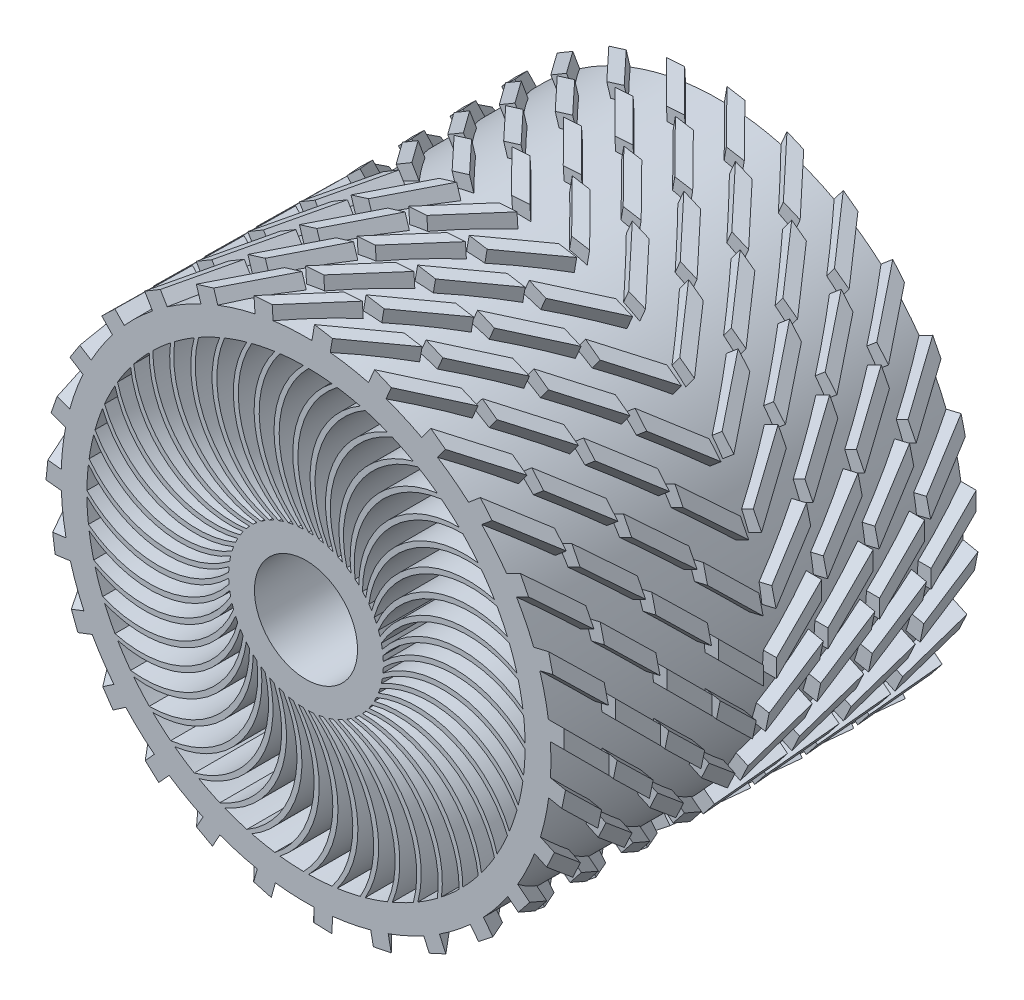
from build123d import *

# Parameters (mm, degrees)
SKETCH1_R           = 120.65
SKETCH1_R_2         = 25.4
BOSS_EXTRUDE2_DEPTH = 203.2
BOSS_EXTRUDE3_REACH = 344.312
CIRPATTERN1_COUNT   = 27
CIRPATTERN1_ANGLE   = 348.4


with BuildPart() as part:
    # Sketch1 → Boss-Extrude2 (new body)
    with BuildSketch(Plane.XY):
        Circle(SKETCH1_R)
        with BuildLine():
            ThreePointArc((1.239671441, 107.942881723), (7.029570809, 107.720878358), (12.799218379, 107.188537208))
            ThreePointArc((12.799218379, 107.188537208), (-6.095938305, 74.436927794), (3.709061895, 37.919030313))
            ThreePointArc((3.709061895, 37.919030313), (2.489766262, 38.018562098), (1.267903716, 38.078897308))
            ThreePointArc((1.267903716, 38.078897308), (-13.219615705, 73.005040764), (1.239671441, 107.942881723))
        make_face(mode=Mode.SUBTRACT)
        with BuildLine():
            ThreePointArc((-1.30119232, 107.942157652), (-15.759755454, 73.004429943), (-1.272096284, 38.078757478))
            ThreePointArc((-1.272096284, 38.078757478), (-2.493952178, 38.018287738), (-3.713236845, 37.918621707))
            ThreePointArc((-3.713236845, 37.918621707), (-22.635590043, 70.654966419), (-12.860307449, 107.181224999))
            ThreePointArc((-12.860307449, 107.181224999), (-7.090964218, 107.716854421), (-1.30119232, 107.942157652))
        make_face(mode=Mode.SUBTRACT)
        Circle(SKETCH1_R_2, mode=Mode.SUBTRACT)
        with BuildLine():
            ThreePointArc((8.626756995, 37.110498026), (7.43088411, 37.368328319), (6.227350094, 37.587632418))
            ThreePointArc((6.227350094, 37.587632418), (-3.577450076, 74.10597862), (15.318439209, 106.857605814))
            ThreePointArc((15.318439209, 106.857605814), (21.029827931, 105.8817682), (26.680630903, 104.600891175))
            ThreePointArc((26.680630903, 104.600891175), (3.672182037, 74.595789173), (8.626756995, 37.110498026))
        make_face(mode=Mode.SUBTRACT)
        with BuildLine():
            ThreePointArc((13.396845892, 35.666994829), (12.244857472, 36.078712082), (11.080244785, 36.453232717))
            ThreePointArc((11.080244785, 36.453232717), (6.125926715, 73.938942636), (29.135104234, 103.943966642))
            ThreePointArc((29.135104234, 103.943966642), (34.670258866, 102.230991632), (40.105530435, 100.223494893))
            ThreePointArc((40.105530435, 100.223494893), (13.377470327, 73.478295917), (13.396845892, 35.666994829))
        make_face(mode=Mode.SUBTRACT)
        with BuildLine():
            ThreePointArc((17.937711041, 33.613219462), (16.849317927, 34.171779079), (15.743553415, 34.695108097))
            ThreePointArc((15.743553415, 34.695108097), (15.724487202, 72.506790844), (42.453259549, 99.251817382))
            ThreePointArc((42.453259549, 99.251817382), (47.71747206, 96.831014454), (52.844213222, 94.131246826))
            ThreePointArc((52.844213222, 94.131246826), (22.853866391, 71.103568646), (17.937711041, 33.613219462))
        make_face(mode=Mode.SUBTRACT)
        with BuildLine():
            ThreePointArc((22.171656981, 30.98431259), (21.165481881, 31.680157461), (20.137485482, 32.343340558))
            ThreePointArc((20.137485482, 32.343340558), (25.053997353, 69.834027758), (55.045027822, 92.861442009))
            ThreePointArc((55.045027822, 92.861442009), (59.948226077, 89.774231772), (64.678716869, 86.428387027))
            ThreePointArc((64.678716869, 86.428387027), (31.939226465, 67.512239602), (22.171656981, 30.984312591))
        make_face(mode=Mode.SUBTRACT)
        with BuildLine():
            ThreePointArc((26.026239723, 27.82525554), (25.119498571, 28.646479566), (24.186859589, 29.438169495))
            ThreePointArc((24.186859589, 29.438169495), (33.954826663, 65.966385095), (66.694960408, 84.882181618))
            ThreePointArc((66.694960408, 84.882181618), (71.153249325, 81.181387094), (75.406549739, 77.246713565))
            ThreePointArc((75.406549739, 77.246713565), (40.478097518, 62.76575742), (26.026239723, 27.82525554))
        make_face(mode=Mode.SUBTRACT)
        with BuildLine():
            ThreePointArc((29.435506288, 24.190100653), (28.643713677, 25.122652463), (27.822389822, 26.029303191))
            ThreePointArc((27.822389822, 26.029303191), (42.274679475, 60.970039294), (77.20372373, 75.450563565))
            ThreePointArc((77.20372373, 75.450563565), (81.14082075, 71.199506375), (84.844155635, 66.743327416))
            ThreePointArc((84.844155635, 66.743327416), (48.3243771, 56.945335727), (29.435506288, 24.190100653))
        make_face(mode=Mode.SUBTRACT)
        with BuildLine():
            ThreePointArc((32.341123178, 20.141046436), (31.6778269, 21.168969811), (30.981871252, 22.175068291))
            ThreePointArc((30.981871252, 22.175068291), (49.871200801, 54.930479217), (86.391509934, 64.727965451))
            ThreePointArc((86.391509934, 64.727965451), (89.740050235, 59.999382361), (92.830054506, 55.09794443))
            ThreePointArc((92.830054506, 55.09794443), (55.343813192, 50.150563552), (32.341123178, 20.141046436))
        make_face(mode=Mode.SUBTRACT)
        with BuildLine():
            ThreePointArc((34.693374485, 15.747373332), (34.169923723, 16.853080217), (33.611244275, 17.941411826))
            ThreePointArc((33.611244275, 17.941411826), (56.614412053, 47.95104341), (94.101113451, 52.897853901))
            ThreePointArc((94.101113451, 52.897853901), (96.803802581, 47.772652281), (99.227605407, 42.509820339))
            ThreePointArc((99.227605407, 42.509820339), (61.416301297, 42.497701329), (34.693374485, 15.747373332))
        make_face(mode=Mode.SUBTRACT)
        with BuildLine():
            ThreePointArc((36.452012535, 11.084258303), (36.077363676, 12.248829747), (35.665519589, 13.40077283))
            ThreePointArc((35.665519589, 13.40077283), (62.388935019, 40.151151957), (100.200620826, 40.162645406))
            ThreePointArc((100.200620826, 40.162645406), (102.211215024, 34.728518875), (103.927344468, 29.194341436))
            ThreePointArc((103.927344468, 29.194341436), (66.437939458, 34.117691655), (36.452012535, 11.084258303))
        make_face(mode=Mode.SUBTRACT)
        with BuildLine():
            ThreePointArc((37.586946545, 6.231488542), (37.367509935, 7.434998405), (37.109547975, 8.630842895))
            ThreePointArc((37.109547975, 8.630842895), (67.09596601, 31.664263161), (104.585667799, 26.740242912))
            ThreePointArc((104.585667799, 26.740242912), (105.869765241, 21.090170882), (106.848857851, 15.379339257))
            ThreePointArc((106.848857851, 15.379339257), (70.322806055, 25.153918817), (37.586946545, 6.231488542))
        make_face(mode=Mode.SUBTRACT)
        with BuildLine():
            ThreePointArc((38.078757478, 1.272096284), (38.018287738, 2.493952178), (37.918621707, 3.713236845))
            ThreePointArc((37.918621707, 3.713236845), (70.654966419, 22.635590043), (107.181224999, 12.860307449))
            ThreePointArc((107.181224999, 12.860307449), (107.716854421, 7.090964218), (107.942157652, 1.30119232))
            ThreePointArc((107.942157652, 1.30119232), (73.004429943, 15.759755454), (38.078757478, 1.272096284))
        make_face(mode=Mode.SUBTRACT)
        with BuildLine():
            ThreePointArc((37.919030313, -3.709061895), (38.018562098, -2.489766262), (38.078897308, -1.267903716))
            ThreePointArc((38.078897308, -1.267903716), (73.005040764, 13.219615705), (107.942881723, -1.239671441))
            ThreePointArc((107.942881723, -1.239671441), (107.720878358, -7.029570809), (107.188537208, -12.799218379))
            ThreePointArc((107.188537208, -12.799218379), (74.436927794, 6.095938305), (37.919030313, -3.709061895))
        make_face(mode=Mode.SUBTRACT)
        with BuildLine():
            ThreePointArc((37.110498026, -8.626756995), (37.368328319, -7.43088411), (37.587632418, -6.227350094))
            ThreePointArc((37.587632418, -6.227350094), (74.10597862, 3.577450076), (106.857605814, -15.318439209))
            ThreePointArc((106.857605814, -15.318439209), (105.8817682, -21.029827931), (104.600891175, -26.680630903))
            ThreePointArc((104.600891175, -26.680630903), (74.595789173, -3.672182037), (37.110498026, -8.626756995))
        make_face(mode=Mode.SUBTRACT)
        with BuildLine():
            ThreePointArc((35.666994829, -13.396845892), (36.078712082, -12.244857472), (36.453232717, -11.080244785))
            ThreePointArc((36.453232717, -11.080244785), (73.938942636, -6.125926715), (103.943966642, -29.135104234))
            ThreePointArc((103.943966642, -29.135104234), (102.230991632, -34.670258866), (100.223494893, -40.105530435))
            ThreePointArc((100.223494893, -40.105530435), (73.478295917, -13.377470327), (35.666994829, -13.396845892))
        make_face(mode=Mode.SUBTRACT)
        with BuildLine():
            ThreePointArc((33.613219462, -17.937711041), (34.171779079, -16.849317927), (34.695108097, -15.743553415))
            ThreePointArc((34.695108097, -15.743553415), (72.506790844, -15.724487202), (99.251817382, -42.453259549))
            ThreePointArc((99.251817382, -42.453259549), (96.831014454, -47.71747206), (94.131246826, -52.844213222))
            ThreePointArc((94.131246826, -52.844213222), (71.103568646, -22.853866391), (33.613219462, -17.937711041))
        make_face(mode=Mode.SUBTRACT)
        with BuildLine():
            ThreePointArc((30.984312591, -22.171656981), (31.680157461, -21.165481881), (32.343340558, -20.137485482))
            ThreePointArc((32.343340558, -20.137485482), (69.834027758, -25.053997353), (92.861442009, -55.045027822))
            ThreePointArc((92.861442009, -55.045027822), (89.774231772, -59.948226077), (86.428387027, -64.678716869))
            ThreePointArc((86.428387027, -64.678716869), (67.512239602, -31.939226465), (30.984312591, -22.171656981))
        make_face(mode=Mode.SUBTRACT)
        with BuildLine():
            ThreePointArc((27.82525554, -26.026239723), (28.646479566, -25.119498571), (29.438169495, -24.186859589))
            ThreePointArc((29.438169495, -24.186859589), (65.966385095, -33.954826663), (84.882181618, -66.694960408))
            ThreePointArc((84.882181618, -66.694960408), (81.181387094, -71.153249325), (77.246713565, -75.406549739))
            ThreePointArc((77.246713565, -75.406549739), (62.76575742, -40.478097518), (27.82525554, -26.026239723))
        make_face(mode=Mode.SUBTRACT)
        with BuildLine():
            ThreePointArc((24.190100653, -29.435506288), (25.122652463, -28.643713677), (26.029303191, -27.822389822))
            ThreePointArc((26.029303191, -27.822389822), (60.970039294, -42.274679475), (75.450563565, -77.20372373))
            ThreePointArc((75.450563565, -77.20372373), (71.199506375, -81.14082075), (66.743327416, -84.844155635))
            ThreePointArc((66.743327416, -84.844155635), (56.945335727, -48.3243771), (24.190100653, -29.435506288))
        make_face(mode=Mode.SUBTRACT)
        with BuildLine():
            ThreePointArc((20.141046436, -32.341123178), (21.168969811, -31.6778269), (22.175068291, -30.981871252))
            ThreePointArc((22.175068291, -30.981871252), (54.930479217, -49.871200801), (64.727965451, -86.391509934))
            ThreePointArc((64.727965451, -86.391509934), (59.999382361, -89.740050235), (55.09794443, -92.830054506))
            ThreePointArc((55.09794443, -92.830054506), (50.150563552, -55.343813192), (20.141046436, -32.341123178))
        make_face(mode=Mode.SUBTRACT)
        with BuildLine():
            ThreePointArc((15.747373332, -34.693374485), (16.853080217, -34.169923723), (17.941411826, -33.611244275))
            ThreePointArc((17.941411826, -33.611244275), (47.95104341, -56.614412053), (52.897853901, -94.101113451))
            ThreePointArc((52.897853901, -94.101113451), (47.772652281, -96.803802581), (42.509820339, -99.227605407))
            ThreePointArc((42.509820339, -99.227605407), (42.497701329, -61.416301297), (15.747373332, -34.693374485))
        make_face(mode=Mode.SUBTRACT)
        with BuildLine():
            ThreePointArc((11.084258303, -36.452012535), (12.248829747, -36.077363676), (13.40077283, -35.665519589))
            ThreePointArc((13.40077283, -35.665519589), (40.151151957, -62.388935019), (40.162645406, -100.200620826))
            ThreePointArc((40.162645406, -100.200620826), (34.728518875, -102.211215024), (29.194341436, -103.927344468))
            ThreePointArc((29.194341436, -103.927344468), (34.117691655, -66.437939458), (11.084258303, -36.452012535))
        make_face(mode=Mode.SUBTRACT)
        with BuildLine():
            ThreePointArc((6.231488542, -37.586946545), (7.434998405, -37.367509935), (8.630842895, -37.109547975))
            ThreePointArc((8.630842895, -37.109547975), (31.664263161, -67.09596601), (26.740242912, -104.585667799))
            ThreePointArc((26.740242912, -104.585667799), (21.090170882, -105.869765241), (15.379339257, -106.848857851))
            ThreePointArc((15.379339257, -106.848857851), (25.153918817, -70.322806055), (6.231488542, -37.586946545))
        make_face(mode=Mode.SUBTRACT)
        with BuildLine():
            ThreePointArc((1.272096284, -38.078757478), (2.493952178, -38.018287738), (3.713236845, -37.918621707))
            ThreePointArc((3.713236845, -37.918621707), (22.635590043, -70.654966419), (12.860307449, -107.181224999))
            ThreePointArc((12.860307449, -107.181224999), (7.090964218, -107.716854421), (1.30119232, -107.942157652))
            ThreePointArc((1.30119232, -107.942157652), (15.759755454, -73.004429943), (1.272096284, -38.078757478))
        make_face(mode=Mode.SUBTRACT)
        with BuildLine():
            ThreePointArc((-3.709061894, -37.919030313), (-2.489766262, -38.018562098), (-1.267903716, -38.078897308))
            ThreePointArc((-1.267903716, -38.078897308), (13.219615705, -73.005040764), (-1.239671441, -107.942881723))
            ThreePointArc((-1.239671441, -107.942881723), (-7.029570809, -107.720878358), (-12.799218379, -107.188537208))
            ThreePointArc((-12.799218379, -107.188537208), (6.095938305, -74.436927794), (-3.709061894, -37.919030313))
        make_face(mode=Mode.SUBTRACT)
        with BuildLine():
            ThreePointArc((-8.626756995, -37.110498026), (-7.43088411, -37.368328319), (-6.227350094, -37.587632418))
            ThreePointArc((-6.227350094, -37.587632418), (3.577450076, -74.10597862), (-15.318439209, -106.857605814))
            ThreePointArc((-15.318439209, -106.857605814), (-21.029827931, -105.8817682), (-26.680630903, -104.600891175))
            ThreePointArc((-26.680630903, -104.600891175), (-3.672182037, -74.595789173), (-8.626756995, -37.110498026))
        make_face(mode=Mode.SUBTRACT)
        with BuildLine():
            ThreePointArc((-13.396845892, -35.666994829), (-12.244857472, -36.078712082), (-11.080244785, -36.453232717))
            ThreePointArc((-11.080244785, -36.453232717), (-6.125926715, -73.938942636), (-29.135104234, -103.943966642))
            ThreePointArc((-29.135104234, -103.943966642), (-34.670258866, -102.230991632), (-40.105530435, -100.223494893))
            ThreePointArc((-40.105530435, -100.223494893), (-13.377470327, -73.478295917), (-13.396845892, -35.666994829))
        make_face(mode=Mode.SUBTRACT)
        with BuildLine():
            ThreePointArc((-17.937711041, -33.613219462), (-16.849317927, -34.171779079), (-15.743553415, -34.695108097))
            ThreePointArc((-15.743553415, -34.695108097), (-15.724487202, -72.506790844), (-42.453259549, -99.251817382))
            ThreePointArc((-42.453259549, -99.251817382), (-47.71747206, -96.831014454), (-52.844213222, -94.131246826))
            ThreePointArc((-52.844213222, -94.131246826), (-22.853866391, -71.103568646), (-17.937711041, -33.613219462))
        make_face(mode=Mode.SUBTRACT)
        with BuildLine():
            ThreePointArc((-22.171656981, -30.984312591), (-21.165481881, -31.680157461), (-20.137485482, -32.343340558))
            ThreePointArc((-20.137485482, -32.343340558), (-25.053997353, -69.834027758), (-55.045027822, -92.861442009))
            ThreePointArc((-55.045027822, -92.861442009), (-59.948226077, -89.774231772), (-64.678716869, -86.428387027))
            ThreePointArc((-64.678716869, -86.428387027), (-31.939226465, -67.512239602), (-22.171656981, -30.984312591))
        make_face(mode=Mode.SUBTRACT)
        with BuildLine():
            ThreePointArc((-26.026239723, -27.82525554), (-25.119498571, -28.646479566), (-24.186859589, -29.438169495))
            ThreePointArc((-24.186859589, -29.438169495), (-33.954826663, -65.966385095), (-66.694960408, -84.882181618))
            ThreePointArc((-66.694960408, -84.882181618), (-71.153249325, -81.181387094), (-75.406549739, -77.246713565))
            ThreePointArc((-75.406549739, -77.246713565), (-40.478097518, -62.76575742), (-26.026239723, -27.82525554))
        make_face(mode=Mode.SUBTRACT)
        with BuildLine():
            ThreePointArc((-29.435506288, -24.190100653), (-28.643713677, -25.122652463), (-27.822389822, -26.029303191))
            ThreePointArc((-27.822389822, -26.029303191), (-42.274679475, -60.970039294), (-77.20372373, -75.450563565))
            ThreePointArc((-77.20372373, -75.450563565), (-81.14082075, -71.199506375), (-84.844155635, -66.743327416))
            ThreePointArc((-84.844155635, -66.743327416), (-48.3243771, -56.945335727), (-29.435506288, -24.190100653))
        make_face(mode=Mode.SUBTRACT)
        with BuildLine():
            ThreePointArc((-32.341123178, -20.141046436), (-31.6778269, -21.168969811), (-30.981871252, -22.175068291))
            ThreePointArc((-30.981871252, -22.175068291), (-49.871200801, -54.930479217), (-86.391509934, -64.727965451))
            ThreePointArc((-86.391509934, -64.727965451), (-89.740050235, -59.999382361), (-92.830054506, -55.09794443))
            ThreePointArc((-92.830054506, -55.09794443), (-55.343813192, -50.150563552), (-32.341123178, -20.141046436))
        make_face(mode=Mode.SUBTRACT)
        with BuildLine():
            ThreePointArc((-34.693374485, -15.747373332), (-34.169923723, -16.853080217), (-33.611244275, -17.941411826))
            ThreePointArc((-33.611244275, -17.941411826), (-56.614412053, -47.95104341), (-94.101113451, -52.897853901))
            ThreePointArc((-94.101113451, -52.897853901), (-96.803802581, -47.772652281), (-99.227605407, -42.509820339))
            ThreePointArc((-99.227605407, -42.509820339), (-61.416301297, -42.497701329), (-34.693374485, -15.747373332))
        make_face(mode=Mode.SUBTRACT)
        with BuildLine():
            ThreePointArc((-36.452012535, -11.084258303), (-36.077363676, -12.248829747), (-35.665519589, -13.40077283))
            ThreePointArc((-35.665519589, -13.40077283), (-62.388935019, -40.151151957), (-100.200620826, -40.162645406))
            ThreePointArc((-100.200620826, -40.162645406), (-102.211215024, -34.728518875), (-103.927344468, -29.194341436))
            ThreePointArc((-103.927344468, -29.194341436), (-66.437939458, -34.117691655), (-36.452012535, -11.084258303))
        make_face(mode=Mode.SUBTRACT)
        with BuildLine():
            ThreePointArc((-37.586946545, -6.231488542), (-37.367509935, -7.434998405), (-37.109547975, -8.630842895))
            ThreePointArc((-37.109547975, -8.630842895), (-67.09596601, -31.664263161), (-104.585667799, -26.740242912))
            ThreePointArc((-104.585667799, -26.740242912), (-105.869765241, -21.090170882), (-106.848857851, -15.379339257))
            ThreePointArc((-106.848857851, -15.379339257), (-70.322806055, -25.153918817), (-37.586946545, -6.231488542))
        make_face(mode=Mode.SUBTRACT)
        with BuildLine():
            ThreePointArc((-38.078757478, -1.272096284), (-38.018287738, -2.493952178), (-37.918621707, -3.713236845))
            ThreePointArc((-37.918621707, -3.713236845), (-70.654966419, -22.635590043), (-107.181224999, -12.860307449))
            ThreePointArc((-107.181224999, -12.860307449), (-107.716854421, -7.090964218), (-107.942157652, -1.30119232))
            ThreePointArc((-107.942157652, -1.30119232), (-73.004429943, -15.759755454), (-38.078757478, -1.272096284))
        make_face(mode=Mode.SUBTRACT)
        with BuildLine():
            ThreePointArc((-37.919030313, 3.709061895), (-38.018562098, 2.489766262), (-38.078897308, 1.267903716))
            ThreePointArc((-38.078897308, 1.267903716), (-73.005040764, -13.219615705), (-107.942881723, 1.239671441))
            ThreePointArc((-107.942881723, 1.239671441), (-107.720878358, 7.029570809), (-107.188537208, 12.799218379))
            ThreePointArc((-107.188537208, 12.799218379), (-74.436927794, -6.095938305), (-37.919030313, 3.709061895))
        make_face(mode=Mode.SUBTRACT)
        with BuildLine():
            ThreePointArc((-37.110498026, 8.626756995), (-37.368328319, 7.43088411), (-37.587632418, 6.227350094))
            ThreePointArc((-37.587632418, 6.227350094), (-74.10597862, -3.577450076), (-106.857605814, 15.318439209))
            ThreePointArc((-106.857605814, 15.318439209), (-105.8817682, 21.029827931), (-104.600891175, 26.680630903))
            ThreePointArc((-104.600891175, 26.680630903), (-74.595789173, 3.672182037), (-37.110498026, 8.626756995))
        make_face(mode=Mode.SUBTRACT)
        with BuildLine():
            ThreePointArc((-35.666994829, 13.396845892), (-36.078712082, 12.244857472), (-36.453232717, 11.080244785))
            ThreePointArc((-36.453232717, 11.080244785), (-73.938942636, 6.125926715), (-103.943966642, 29.135104234))
            ThreePointArc((-103.943966642, 29.135104234), (-102.230991632, 34.670258866), (-100.223494893, 40.105530435))
            ThreePointArc((-100.223494893, 40.105530435), (-73.478295917, 13.377470327), (-35.666994829, 13.396845892))
        make_face(mode=Mode.SUBTRACT)
        with BuildLine():
            ThreePointArc((-33.613219462, 17.937711041), (-34.171779079, 16.849317927), (-34.695108097, 15.743553415))
            ThreePointArc((-34.695108097, 15.743553415), (-72.506790844, 15.724487202), (-99.251817382, 42.453259549))
            ThreePointArc((-99.251817382, 42.453259549), (-96.831014454, 47.71747206), (-94.131246826, 52.844213222))
            ThreePointArc((-94.131246826, 52.844213222), (-71.103568646, 22.853866391), (-33.613219462, 17.937711041))
        make_face(mode=Mode.SUBTRACT)
        with BuildLine():
            ThreePointArc((-30.984312591, 22.171656981), (-31.680157461, 21.165481881), (-32.343340558, 20.137485482))
            ThreePointArc((-32.343340558, 20.137485482), (-69.834027758, 25.053997353), (-92.861442009, 55.045027822))
            ThreePointArc((-92.861442009, 55.045027822), (-89.774231772, 59.948226077), (-86.428387027, 64.678716869))
            ThreePointArc((-86.428387027, 64.678716869), (-67.512239602, 31.939226465), (-30.98431259, 22.171656981))
        make_face(mode=Mode.SUBTRACT)
        with BuildLine():
            ThreePointArc((-27.82525554, 26.026239723), (-28.646479566, 25.119498571), (-29.438169495, 24.186859589))
            ThreePointArc((-29.438169495, 24.186859589), (-65.966385095, 33.954826663), (-84.882181618, 66.694960408))
            ThreePointArc((-84.882181618, 66.694960408), (-81.181387094, 71.153249325), (-77.246713565, 75.406549739))
            ThreePointArc((-77.246713564, 75.406549739), (-62.76575742, 40.478097518), (-27.82525554, 26.026239723))
        make_face(mode=Mode.SUBTRACT)
        with BuildLine():
            ThreePointArc((-24.190100653, 29.435506288), (-25.122652463, 28.643713677), (-26.029303191, 27.822389822))
            ThreePointArc((-26.029303191, 27.822389822), (-60.970039294, 42.274679475), (-75.450563565, 77.20372373))
            ThreePointArc((-75.450563565, 77.20372373), (-71.199506375, 81.14082075), (-66.743327416, 84.844155635))
            ThreePointArc((-66.743327416, 84.844155635), (-56.945335727, 48.3243771), (-24.190100653, 29.435506288))
        make_face(mode=Mode.SUBTRACT)
        with BuildLine():
            ThreePointArc((-20.141046436, 32.341123178), (-21.168969811, 31.6778269), (-22.175068291, 30.981871252))
            ThreePointArc((-22.175068291, 30.981871252), (-54.930479217, 49.871200801), (-64.727965451, 86.391509934))
            ThreePointArc((-64.727965451, 86.391509934), (-59.999382361, 89.740050236), (-55.09794443, 92.830054506))
            ThreePointArc((-55.09794443, 92.830054506), (-50.150563552, 55.343813192), (-20.141046436, 32.341123178))
        make_face(mode=Mode.SUBTRACT)
        with BuildLine():
            ThreePointArc((-15.747373332, 34.693374485), (-16.853080217, 34.169923723), (-17.941411826, 33.611244275))
            ThreePointArc((-17.941411826, 33.611244275), (-47.95104341, 56.614412053), (-52.897853901, 94.101113451))
            ThreePointArc((-52.897853901, 94.101113451), (-47.772652281, 96.803802581), (-42.509820339, 99.227605407))
            ThreePointArc((-42.509820339, 99.227605407), (-42.497701329, 61.416301297), (-15.747373332, 34.693374485))
        make_face(mode=Mode.SUBTRACT)
        with BuildLine():
            ThreePointArc((-11.084258303, 36.452012535), (-12.248829747, 36.077363676), (-13.40077283, 35.665519589))
            ThreePointArc((-13.40077283, 35.665519589), (-40.151151957, 62.388935019), (-40.162645406, 100.200620826))
            ThreePointArc((-40.162645406, 100.200620826), (-34.728518875, 102.211215024), (-29.194341436, 103.927344468))
            ThreePointArc((-29.194341436, 103.927344468), (-34.117691655, 66.437939458), (-11.084258303, 36.452012535))
        make_face(mode=Mode.SUBTRACT)
        with BuildLine():
            ThreePointArc((-6.231488542, 37.586946545), (-7.434998405, 37.367509935), (-8.630842895, 37.109547975))
            ThreePointArc((-8.630842895, 37.109547975), (-31.664263161, 67.09596601), (-26.740242912, 104.585667799))
            ThreePointArc((-26.740242912, 104.585667799), (-21.090170882, 105.869765241), (-15.379339257, 106.848857851))
            ThreePointArc((-15.379339257, 106.848857851), (-25.153918817, 70.322806055), (-6.231488542, 37.586946545))
        make_face(mode=Mode.SUBTRACT)
    extrude(amount=BOSS_EXTRUDE2_DEPTH)

    # Sketch2 → Boss-Extrude3 (add, up to next)
    with BuildSketch(Plane(origin=(127, 0, 0), x_dir=(0, 0, -1), z_dir=(1, 0, 0)), mode=Mode.PRIVATE) as boss_extrude3_sk1:
        Polygon((-203.2, 8.255), (-180.975, -13.97), (-180.975, -4.989743879), (-203.2, 17.235256121), align=None)
    boss_extrude3_tool1 = extrude(boss_extrude3_sk1.sketch, amount=-BOSS_EXTRUDE3_REACH, mode=Mode.PRIVATE) - part.part
    # Sketch2 → Boss-Extrude3 (add, up to next)
    with BuildSketch(Plane(origin=(127, 0, 0), x_dir=(0, 0, -1), z_dir=(1, 0, 0)), mode=Mode.PRIVATE) as boss_extrude3_sk2:
        Polygon((-177.8, 17.235256121), (-177.8, 8.255), (-155.575, -13.97), (-155.575, -4.989743879), align=None)
    boss_extrude3_tool2 = extrude(boss_extrude3_sk2.sketch, amount=-BOSS_EXTRUDE3_REACH, mode=Mode.PRIVATE) - part.part
    # Sketch2 → Boss-Extrude3 (add, up to next)
    with BuildSketch(Plane(origin=(127, 0, 0), x_dir=(0, 0, -1), z_dir=(1, 0, 0)), mode=Mode.PRIVATE) as boss_extrude3_sk3:
        Polygon((-152.4, 17.235256121), (-152.4, 8.255), (-130.175, -13.97), (-130.175, -4.989743879), align=None)
    boss_extrude3_tool3 = extrude(boss_extrude3_sk3.sketch, amount=-BOSS_EXTRUDE3_REACH, mode=Mode.PRIVATE) - part.part
    # Sketch2 → Boss-Extrude3 (add, up to next)
    with BuildSketch(Plane(origin=(127, 0, 0), x_dir=(0, 0, -1), z_dir=(1, 0, 0)), mode=Mode.PRIVATE) as boss_extrude3_sk4:
        Polygon((-127, 17.235256121), (-127, 8.255), (-104.775, -13.97), (-104.775, -4.989743879), align=None)
    boss_extrude3_tool4 = extrude(boss_extrude3_sk4.sketch, amount=-BOSS_EXTRUDE3_REACH, mode=Mode.PRIVATE) - part.part
    # Sketch2 → Boss-Extrude3 (add, up to next)
    with BuildSketch(Plane(origin=(127, 0, 0), x_dir=(0, 0, -1), z_dir=(1, 0, 0)), mode=Mode.PRIVATE) as boss_extrude3_sk5:
        Polygon((-98.425, -4.989743879), (-98.425, -13.97), (-76.2, 8.255), (-76.2, 17.235256121), align=None)
    boss_extrude3_tool5 = extrude(boss_extrude3_sk5.sketch, amount=-BOSS_EXTRUDE3_REACH, mode=Mode.PRIVATE) - part.part
    # Sketch2 → Boss-Extrude3 (add, up to next)
    with BuildSketch(Plane(origin=(127, 0, 0), x_dir=(0, 0, -1), z_dir=(1, 0, 0)), mode=Mode.PRIVATE) as boss_extrude3_sk6:
        Polygon((-50.8, 17.235256121), (-73.025, -4.989743879), (-73.025, -13.97), (-50.8, 8.255), align=None)
    boss_extrude3_tool6 = extrude(boss_extrude3_sk6.sketch, amount=-BOSS_EXTRUDE3_REACH, mode=Mode.PRIVATE) - part.part
    # Sketch2 → Boss-Extrude3 (add, up to next)
    with BuildSketch(Plane(origin=(127, 0, 0), x_dir=(0, 0, -1), z_dir=(1, 0, 0)), mode=Mode.PRIVATE) as boss_extrude3_sk7:
        Polygon((-25.4, 17.235256121), (-47.625, -4.989743879), (-47.625, -13.97), (-25.4, 8.255), align=None)
    boss_extrude3_tool7 = extrude(boss_extrude3_sk7.sketch, amount=-BOSS_EXTRUDE3_REACH, mode=Mode.PRIVATE) - part.part
    # Sketch2 → Boss-Extrude3 (add, up to next)
    with BuildSketch(Plane(origin=(127, 0, 0), x_dir=(0, 0, -1), z_dir=(1, 0, 0)), mode=Mode.PRIVATE) as boss_extrude3_sk8:
        Polygon((0, 17.235256121), (-22.225, -4.989743879), (-22.225, -13.97), (0, 8.255), align=None)
    boss_extrude3_tool8 = extrude(boss_extrude3_sk8.sketch, amount=-BOSS_EXTRUDE3_REACH, mode=Mode.PRIVATE) - part.part
    boss_extrude3_1 = boss_extrude3_tool1.solids().sort_by_distance((127, 1.632628, 192.0875))[0]
    add(boss_extrude3_1)
    boss_extrude3_2 = boss_extrude3_tool2.solids().sort_by_distance((127, 1.632628, 166.6875))[0]
    add(boss_extrude3_2)
    boss_extrude3_3 = boss_extrude3_tool3.solids().sort_by_distance((127, 1.632628, 141.2875))[0]
    add(boss_extrude3_3)
    boss_extrude3_4 = boss_extrude3_tool4.solids().sort_by_distance((127, 1.632628, 115.8875))[0]
    add(boss_extrude3_4)
    boss_extrude3_5 = boss_extrude3_tool5.solids().sort_by_distance((127, 1.632628, 87.3125))[0]
    add(boss_extrude3_5)
    boss_extrude3_6 = boss_extrude3_tool6.solids().sort_by_distance((127, 1.632628, 61.9125))[0]
    add(boss_extrude3_6)
    boss_extrude3_7 = boss_extrude3_tool7.solids().sort_by_distance((127, 1.632628, 36.5125))[0]
    add(boss_extrude3_7)
    boss_extrude3_8 = boss_extrude3_tool8.solids().sort_by_distance((127, 1.632628, 11.1125))[0]
    add(boss_extrude3_8)
    boss_extrude3 = boss_extrude3_1 + boss_extrude3_2 + boss_extrude3_3 + boss_extrude3_4 + boss_extrude3_5 + boss_extrude3_6 + boss_extrude3_7 + boss_extrude3_8  # Boss-Extrude3 as one shape, for the pattern or mirror that repeats it

    # CirPattern1: Boss-Extrude3 ×27 about axis
    cirpattern1_axis = Axis((0, 0, 203.2), (0, 0, 1))
    for i in range(1, CIRPATTERN1_COUNT):
        add(boss_extrude3.rotate(cirpattern1_axis, i * CIRPATTERN1_ANGLE / (CIRPATTERN1_COUNT - 1)))


solid = part.part
